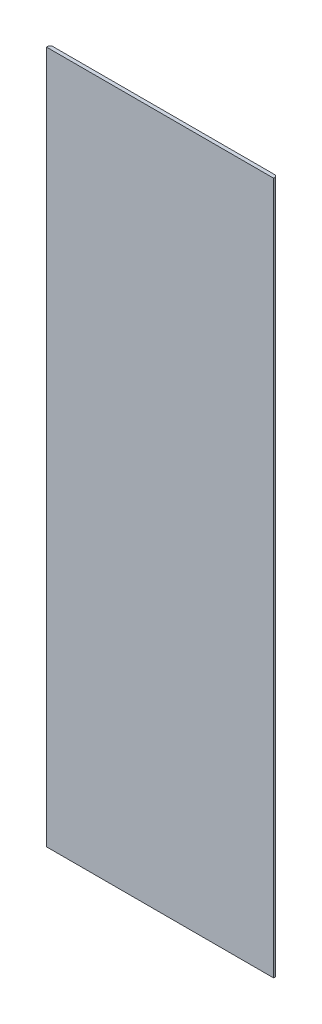
from build123d import *

# Parameters (mm, degrees)
SKETCH1_W           = 98.4125
SKETCH1_H           = 300
BOSS_EXTRUDE1_DEPTH = 0.79375
CHAMFER1_SIZE       = 0.79375


with BuildPart() as part:
    # Sketch1 → Boss-Extrude1 (new, symmetric)
    with BuildSketch(Plane.XY):
        Rectangle(SKETCH1_W, SKETCH1_H)
    extrude(amount=BOSS_EXTRUDE1_DEPTH, both=True)

    # Chamfer1
    chamfer1_edges = [part.edges().sort_by_distance(p)[0] for p in [
        (-49.20625, 0, -0.79375),
        (49.20625, 0, -0.79375),
    ]]
    chamfer(chamfer1_edges, length=CHAMFER1_SIZE)


solid = part.part
